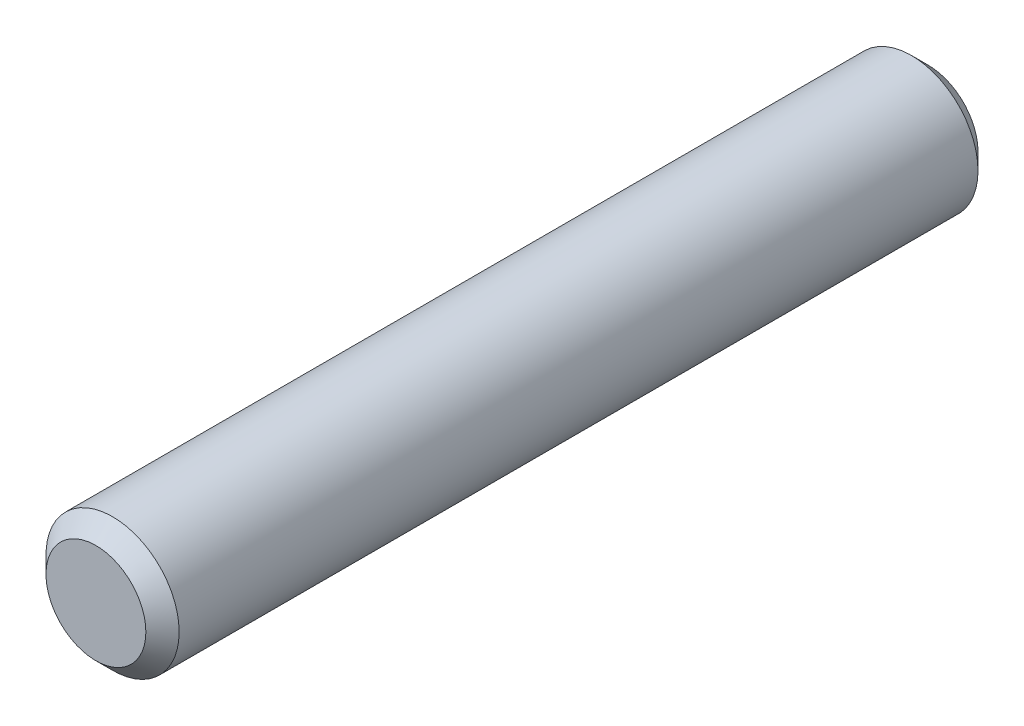
from build123d import *

# Parameters (mm, degrees)
SKETCH1_R           = 4
BOSS_EXTRUDE1_DEPTH = 50
CHAMFER1_SIZE       = 1


with BuildPart() as part:
    # Sketch1 → Boss-Extrude1 (new body)
    with BuildSketch(Plane.XY):
        Circle(SKETCH1_R)
    extrude(amount=BOSS_EXTRUDE1_DEPTH)

    # Chamfer1
    chamfer1_edges = [part.edges().sort_by_distance(p)[0] for p in [
        (-4, 0, 0),
        (-4, 0, 50),
    ]]
    chamfer(chamfer1_edges, length=CHAMFER1_SIZE)


solid = part.part
